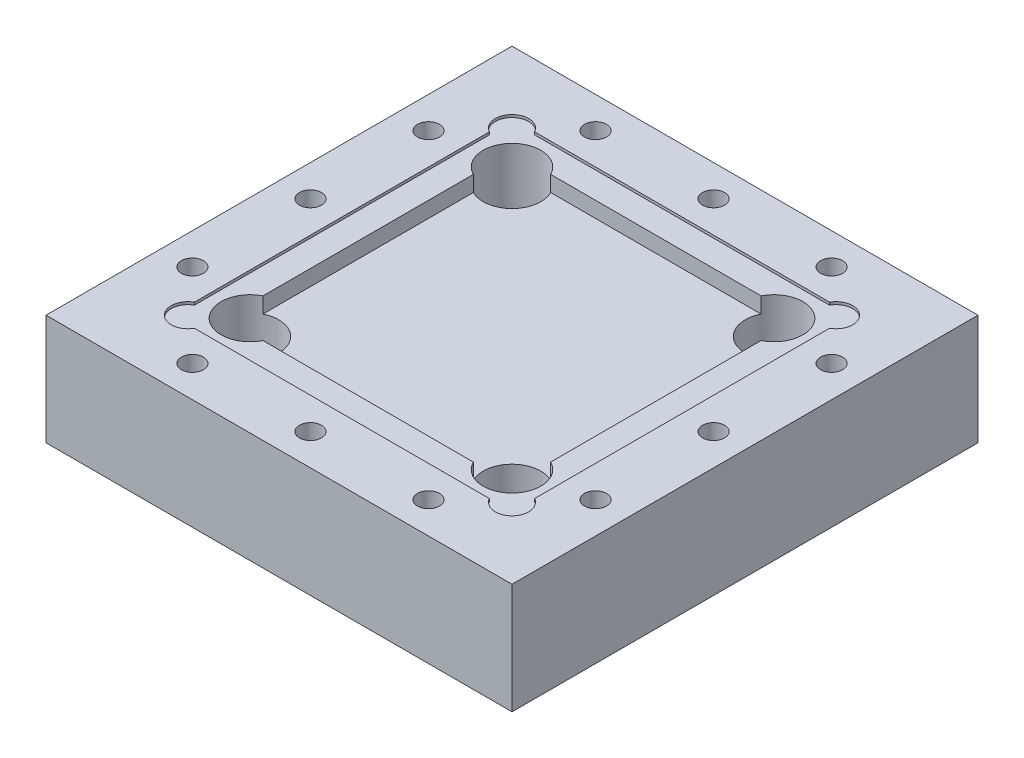
from build123d import *

# Parameters (mm, degrees)
SKETCH1_W                      = 88.9
SKETCH1_H                      = 88.9
BOSS_EXTRUDE1_DEPTH            = 21.082
CUT_EXTRUDE1_DEPTH             = 0.5
SKETCH3_W                      = 54.9
SKETCH3_H                      = 54.9
CUT_EXTRUDE2_DEPTH             = 3
FILLET1_R                      = 6.35
CBORE_FOR_M6_SHCS1_D           = 6.6
CBORE_FOR_M6_SHCS1_CBORE_D     = 11
CBORE_FOR_M6_SHCS1_CBORE_DEPTH = 14.7376
M5X0_8_TAPPED_HOLE1_D          = 4.2


with BuildPart() as part:
    # Sketch1 → Boss-Extrude1 (new body)
    with BuildSketch(Plane(origin=(0, 0, 0), x_dir=(1, 0, 0), z_dir=(0, 1, 0))):
        Rectangle(SKETCH1_W, SKETCH1_H)
    extrude(amount=BOSS_EXTRUDE1_DEPTH)

    # Sketch2 → Cut-Extrude1 (cut)
    with BuildSketch(Plane(origin=(0, 21.082, 0), x_dir=(1, 0, 0), z_dir=(0, 1, 0))):
        with BuildLine():
            Line((28.134397615, -32.45), (-28.134397615, -32.45))
            ThreePointArc((-28.134397615, -32.45), (-33.157106781, -33.157106781), (-32.45, -28.134397615))
            Line((-32.45, -28.134397615), (-32.45, 28.134397615))
            ThreePointArc((-32.45, 28.134397615), (-33.157106781, 33.157106781), (-28.134397615, 32.45))
            Line((-28.134397615, 32.45), (28.134397615, 32.45))
            ThreePointArc((28.134397615, 32.45), (33.157106781, 33.157106781), (32.45, 28.134397615))
            Line((32.45, 28.134397615), (32.45, -28.134397615))
            ThreePointArc((32.45, -28.134397615), (33.157106781, -33.157106781), (28.134397615, -32.45))
        make_face()
    extrude(amount=-CUT_EXTRUDE1_DEPTH, mode=Mode.SUBTRACT)

    # Sketch3 → Cut-Extrude2 (cut)
    with BuildSketch(Plane(origin=(0, 20.582, 0), x_dir=(1, 0, 0), z_dir=(0, 1, 0))):
        Rectangle(SKETCH3_W, SKETCH3_H)
    extrude(amount=-CUT_EXTRUDE2_DEPTH, mode=Mode.SUBTRACT)

    # Fillet1
    fillet1_edges = [part.edges().sort_by_distance(p)[0] for p in [
        (-27.45, 19.082, 27.45),
        (27.45, 19.082, 27.45),
        (27.45, 19.082, -27.45),
        (-27.45, 19.082, -27.45),
    ]]
    fillet(fillet1_edges, radius=FILLET1_R)

    # CBORE for M6 SHCS1 (through all)
    with Locations(Plane(origin=(0, 21.082, 0), x_dir=(1, 0, 0), z_dir=(0, 1, 0))):
        with Locations((-25, 25), (25, 25), (25, -25), (-25, -25)):
            CounterBoreHole(CBORE_FOR_M6_SHCS1_D / 2, CBORE_FOR_M6_SHCS1_CBORE_D / 2, CBORE_FOR_M6_SHCS1_CBORE_DEPTH)

    # M5x0.8 Tapped Hole1 (through all)
    with Locations(Plane(origin=(0, 21.082, 0), x_dir=(1, 0, 0), z_dir=(0, 1, 0))):
        with Locations((-38.45, 22.523488527), (-38.45, 0), (-38.45, -22.523488527), (-22.523488527, -38.45), (0, -38.45), (22.523488527, -38.45), (38.45, -22.523488527), (38.45, 0), (38.45, 22.523488527), (22.523488527, 38.45), (0, 38.45), (-22.523488527, 38.45)):
            Hole(M5X0_8_TAPPED_HOLE1_D / 2)


solid = part.part
